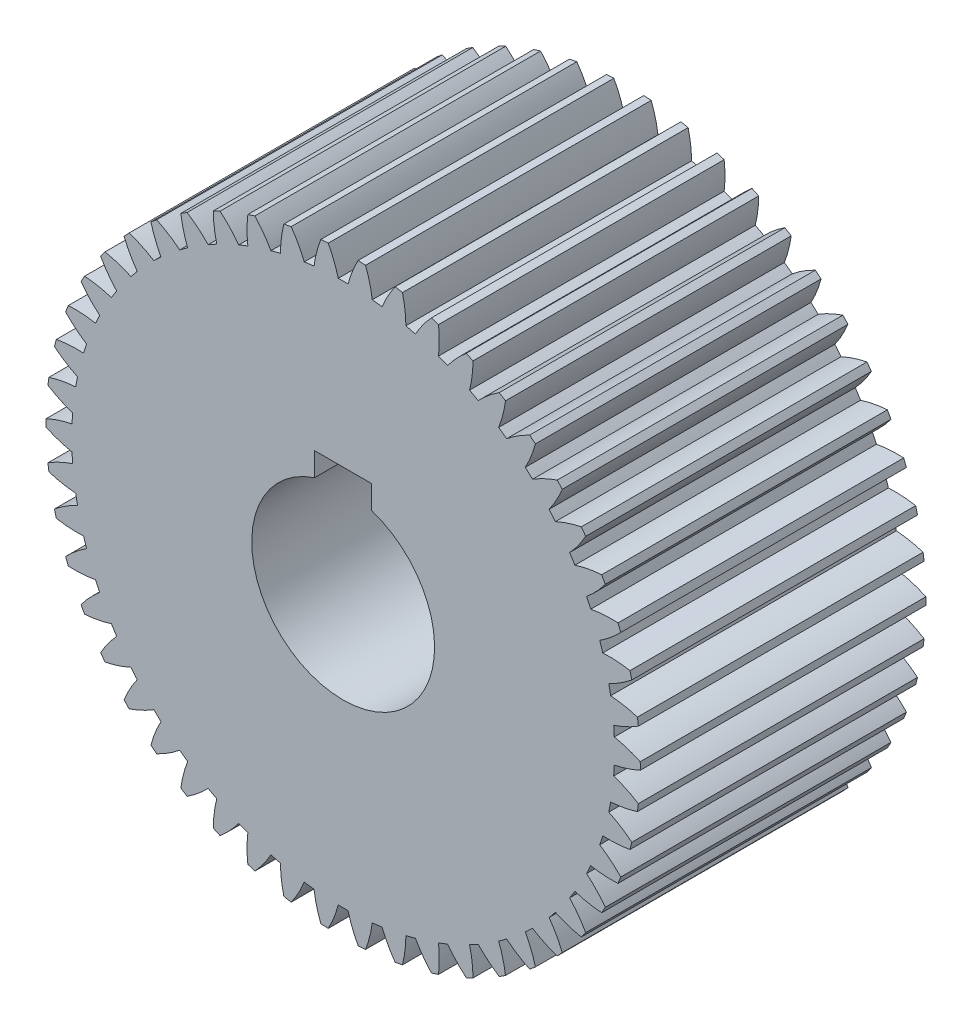
from build123d import *

# Parameters (mm, degrees)
EXTRUDE_1_DEPTH = 50


with BuildPart() as part:
    # Model → 凸台-拉伸1 (new body)
    with BuildSketch(Plane.XY):
        with BuildLine():
            ThreePointArc((-51.995930809, -0.65052232), (-49.767852675, -1.522964689), (-47.451528539, -2.12307331))
            ThreePointArc((-47.451528539, -2.12307331), (-47.405271574, -2.982486887), (-47.343450707, -3.840921267))
            ThreePointArc((-47.343450707, -3.840921267), (-49.566296381, -4.726610245), (-51.66745943, -5.871425384))
            ThreePointArc((-51.66745943, -5.871425384), (-51.589964468, -6.517328145), (-51.504395298, -7.162210897))
            ThreePointArc((-51.504395298, -7.162210897), (-49.184540203, -7.748521561), (-46.811267421, -8.053585752))
            ThreePointArc((-46.811267421, -8.053585752), (-46.657662122, -8.900425062), (-46.488738375, -9.744342221))
            ThreePointArc((-46.488738375, -9.744342221), (-48.583049984, -10.901643713), (-50.524161351, -12.300777201))
            ThreePointArc((-50.524161351, -12.300777201), (-50.366324379, -12.931874133), (-50.200604707, -13.560947131))
            ThreePointArc((-50.200604707, -13.560947131), (-47.82555815, -13.85187962), (-45.432764651, -13.857088336))
            ThreePointArc((-45.432764651, -13.857088336), (-45.174233467, -14.677998216), (-44.900870868, -15.494089076))
            ThreePointArc((-44.900870868, -15.494089076), (-46.833619866, -16.904751747), (-48.584067066, -18.536138414))
            ThreePointArc((-48.584067066, -18.536138414), (-48.348377266, -19.14247674), (-48.10512059, -19.745819127))
            ThreePointArc((-48.10512059, -19.745819127), (-45.712338476, -19.736785261), (-43.337760043, -19.442056359))
            ThreePointArc((-43.337760043, -19.442056359), (-42.978380165, -20.22409057), (-42.604889805, -20.999484892))
            ThreePointArc((-42.604889805, -20.999484892), (-44.345595586, -22.641261748), (-45.877773021, -24.479173651))
            ThreePointArc((-45.877773021, -24.479173651), (-45.567947362, -25.051191053), (-45.250989986, -25.61928776))
            ThreePointArc((-45.250989986, -25.61928776), (-42.878207916, -25.310430009), (-40.55929307, -24.720411539))
            ThreePointArc((-40.55929307, -24.720411539), (-40.104732133, -25.451236935), (-39.637004178, -26.173706286))
            ThreePointArc((-39.637004178, -26.173706286), (-41.158214772, -28.020705525), (-42.447959089, -30.036157697))
            ThreePointArc((-42.447959089, -30.036157697), (-42.068883707, -30.564833119), (-41.683224237, -31.088724921))
            ThreePointArc((-41.683224237, -31.088724921), (-39.367862404, -30.484914156), (-37.141181816, -29.608911062))
            ThreePointArc((-37.141181816, -29.608911062), (-36.598608519, -30.277002089), (-36.044019318, -30.935152697))
            ThreePointArc((-36.044019318, -30.935152697), (-37.321744325, -32.958246038), (-38.348715485, -35.119453593))
            ThreePointArc((-38.348715485, -35.119453593), (-37.906368626, -35.596449508), (-37.458089142, -36.067874318))
            ThreePointArc((-37.458089142, -36.067874318), (-35.236662184, -35.178632996), (-33.137331938, -34.03046037))
            ThreePointArc((-33.137331938, -34.03046037), (-32.515302984, -34.625280834), (-31.882598742, -35.20873327))
            ThreePointArc((-31.882598742, -35.20873327), (-32.896687675, -37.376015322), (-33.644689729, -39.648894727))
            ThreePointArc((-33.644689729, -39.648894727), (-33.146047467, -40.066688624), (-32.642217605, -40.478211791))
            ThreePointArc((-32.642217605, -40.478211791), (-30.549758752, -39.31756378), (-28.610886541, -37.915328989))
            ThreePointArc((-28.610886541, -37.915328989), (-27.919211699, -38.427498216), (-27.218370538, -38.927051086))
            ThreePointArc((-27.218370538, -38.927051086), (-27.952830609, -41.204342518), (-28.410067118, -43.553049105))
            ThreePointArc((-28.410067118, -43.553049105), (-27.862993339, -43.905052126), (-27.311558797, -44.250183684))
            ThreePointArc((-27.311558797, -44.250183684), (-25.381067375, -42.836433095), (-23.633230371, -41.202250221))
            ThreePointArc((-23.633230371, -41.202250221), (-22.882817766, -41.623690995), (-22.12489237, -42.031466054))
            ThreePointArc((-22.12489237, -42.031466054), (-22.568140706, -44.382852617), (-22.727400777, -46.770345882))
            ThreePointArc((-22.727400777, -46.770345882), (-22.140523161, -47.051006728), (-21.550180391, -47.324303747))
            ThreePointArc((-21.550180391, -47.324303747), (-19.812101404, -45.67974627), (-18.28286404, -43.839387353))
            ThreePointArc((-18.28286404, -43.839387353), (-17.485548128, -44.163453303), (-16.682491434, -44.473019692))
            ThreePointArc((-16.682491434, -44.473019692), (-16.827537742, -46.861418618), (-16.686309749, -49.250046365))
            ThreePointArc((-16.686309749, -49.250046365), (-16.068883708, -49.454938847), (-15.448942767, -49.652091269))
            ThreePointArc((-15.448942767, -49.652091269), (-13.930686758, -47.80266256), (-12.644166022, -45.785151159))
            ThreePointArc((-12.644166022, -45.785151159), (-11.81252095, -46.00673157), (-10.976997641, -46.213207244))
            ThreePointArc((-10.976997641, -46.213207244), (-10.821554456, -48.600952054), (-10.382065649, -50.953044196))
            ThreePointArc((-10.382065649, -50.953044196), (-9.743828358, -51.078937038), (-9.104066087, -51.196835651))
            ThreePointArc((-9.104066087, -51.196835651), (-7.829576861, -49.171702305), (-6.806061952, -47.00885578))
            ThreePointArc((-6.806061952, -47.00885578), (-5.953203261, -47.124456198), (-5.098390039, -47.224584911))
            ThreePointArc((-5.098390039, -47.224584911), (-4.644908792, -49.574019442), (-3.914090171, -51.852482083))
            ThreePointArc((-3.914090171, -51.852482083), (-3.265107016, -51.897389878), (-2.615612847, -51.934175352))
            ThreePointArc((-2.615612847, -51.934175352), (-1.604989859, -49.765274931), (-0.86062222, -47.491202663))
            ThreePointArc((-0.86062222, -47.491202663), (0, -47.499), (0.86062222, -47.491202663))
            ThreePointArc((0.86062222, -47.491202663), (1.604989859, -49.765274931), (2.615612847, -51.934175351))
            ThreePointArc((2.615612847, -51.934175351), (3.265107015, -51.897389878), (3.914090171, -51.852482083))
            ThreePointArc((3.914090171, -51.852482083), (4.644908792, -49.574019442), (5.098390039, -47.224584911))
            ThreePointArc((5.098390039, -47.224584911), (5.953203261, -47.124456198), (6.806061952, -47.00885578))
            ThreePointArc((6.806061952, -47.00885578), (7.829576861, -49.171702305), (9.104066087, -51.196835651))
            ThreePointArc((9.104066087, -51.196835651), (9.743828358, -51.078937038), (10.382065649, -50.953044196))
            ThreePointArc((10.382065649, -50.953044196), (10.821554456, -48.600952054), (10.976997641, -46.213207244))
            ThreePointArc((10.976997641, -46.213207244), (11.81252095, -46.00673157), (12.644166022, -45.785151159))
            ThreePointArc((12.644166022, -45.785151159), (13.930686758, -47.80266256), (15.448942767, -49.652091269))
            ThreePointArc((15.448942767, -49.652091269), (16.068883707, -49.454938847), (16.686309749, -49.250046365))
            ThreePointArc((16.686309749, -49.250046365), (16.827537742, -46.861418618), (16.682491434, -44.473019692))
            ThreePointArc((16.682491434, -44.473019692), (17.485548128, -44.163453303), (18.28286404, -43.839387353))
            ThreePointArc((18.28286404, -43.839387353), (19.812101404, -45.67974627), (21.550180391, -47.324303747))
            ThreePointArc((21.550180391, -47.324303747), (22.140523161, -47.051006728), (22.727400777, -46.770345882))
            ThreePointArc((22.727400777, -46.770345882), (22.568140706, -44.382852617), (22.12489237, -42.031466053))
            ThreePointArc((22.12489237, -42.031466053), (22.882817766, -41.623690995), (23.633230371, -41.202250221))
            ThreePointArc((23.633230371, -41.202250221), (25.381067375, -42.836433095), (27.311558797, -44.250183684))
            ThreePointArc((27.311558797, -44.250183684), (27.862993339, -43.905052126), (28.410067118, -43.553049105))
            ThreePointArc((28.410067118, -43.553049105), (27.952830609, -41.204342518), (27.218370537, -38.927051086))
            ThreePointArc((27.218370537, -38.927051086), (27.919211699, -38.427498216), (28.610886541, -37.915328989))
            ThreePointArc((28.610886541, -37.915328989), (30.549758752, -39.31756378), (32.642217605, -40.478211791))
            ThreePointArc((32.642217605, -40.478211791), (33.146047467, -40.066688624), (33.644689729, -39.648894727))
            ThreePointArc((33.644689729, -39.648894727), (32.896687675, -37.376015322), (31.882598742, -35.20873327))
            ThreePointArc((31.882598742, -35.20873327), (32.515302985, -34.625280834), (33.137331938, -34.03046037))
            ThreePointArc((33.137331938, -34.03046037), (35.236662184, -35.178632997), (37.458089142, -36.067874318))
            ThreePointArc((37.458089142, -36.067874318), (37.906368626, -35.596449508), (38.348715485, -35.119453593))
            ThreePointArc((38.348715485, -35.119453593), (37.321744325, -32.958246038), (36.044019318, -30.935152697))
            ThreePointArc((36.044019318, -30.935152697), (36.598608519, -30.277002089), (37.141181816, -29.608911062))
            ThreePointArc((37.141181816, -29.608911062), (39.367862404, -30.484914156), (41.683224237, -31.088724921))
            ThreePointArc((41.683224237, -31.088724921), (42.068883708, -30.564833119), (42.447959089, -30.036157697))
            ThreePointArc((42.447959089, -30.036157697), (41.158214772, -28.020705525), (39.637004178, -26.173706286))
            ThreePointArc((39.637004178, -26.173706286), (40.104732133, -25.451236935), (40.55929307, -24.720411539))
            ThreePointArc((40.55929307, -24.720411539), (42.878207916, -25.310430009), (45.250989986, -25.61928776))
            ThreePointArc((45.250989986, -25.61928776), (45.567947362, -25.051191053), (45.877773021, -24.479173651))
            ThreePointArc((45.877773021, -24.479173651), (44.345595586, -22.641261748), (42.604889805, -20.999484892))
            ThreePointArc((42.604889805, -20.999484892), (42.978380165, -20.22409057), (43.337760043, -19.442056359))
            ThreePointArc((43.337760043, -19.442056359), (45.712338476, -19.736785261), (48.10512059, -19.745819127))
            ThreePointArc((48.10512059, -19.745819127), (48.348377266, -19.14247674), (48.584067066, -18.536138414))
            ThreePointArc((48.584067066, -18.536138414), (46.833619866, -16.904751747), (44.900870868, -15.494089076))
            ThreePointArc((44.900870868, -15.494089076), (45.174233468, -14.677998216), (45.432764651, -13.857088336))
            ThreePointArc((45.432764651, -13.857088336), (47.82555815, -13.85187962), (50.200604707, -13.560947131))
            ThreePointArc((50.200604707, -13.560947131), (50.366324379, -12.931874133), (50.524161351, -12.300777201))
            ThreePointArc((50.524161351, -12.300777201), (48.583049984, -10.901643713), (46.488738375, -9.744342221))
            ThreePointArc((46.488738375, -9.744342221), (46.657662122, -8.900425061), (46.811267421, -8.053585752))
            ThreePointArc((46.811267421, -8.053585752), (49.184540203, -7.748521561), (51.504395298, -7.162210897))
            ThreePointArc((51.504395298, -7.162210897), (51.589964468, -6.517328145), (51.66745943, -5.871425384))
            ThreePointArc((51.66745943, -5.871425384), (49.566296381, -4.726610245), (47.343450707, -3.840921267))
            ThreePointArc((47.343450707, -3.840921267), (47.405271574, -2.982486887), (47.451528539, -2.12307331))
            ThreePointArc((47.451528539, -2.12307331), (49.767852675, -1.522964689), (51.995930809, -0.65052232))
            ThreePointArc((51.995930809, -0.65052232), (52, 0), (51.995930809, 0.65052232))
            ThreePointArc((51.995930809, 0.65052232), (49.767852675, 1.522964689), (47.451528539, 2.12307331))
            ThreePointArc((47.451528539, 2.12307331), (47.405271574, 2.982486887), (47.343450707, 3.840921267))
            ThreePointArc((47.343450707, 3.840921267), (49.566296381, 4.726610245), (51.66745943, 5.871425384))
            ThreePointArc((51.66745943, 5.871425384), (51.589964468, 6.517328145), (51.504395298, 7.162210897))
            ThreePointArc((51.504395298, 7.162210897), (49.184540203, 7.748521561), (46.811267421, 8.053585752))
            ThreePointArc((46.811267421, 8.053585752), (46.657662122, 8.900425062), (46.488738375, 9.744342221))
            ThreePointArc((46.488738375, 9.744342221), (48.583049984, 10.901643713), (50.524161351, 12.300777201))
            ThreePointArc((50.524161351, 12.300777201), (50.366324379, 12.931874133), (50.200604707, 13.560947131))
            ThreePointArc((50.200604707, 13.560947131), (47.82555815, 13.85187962), (45.432764651, 13.857088336))
            ThreePointArc((45.432764651, 13.857088336), (45.174233468, 14.677998216), (44.900870868, 15.494089076))
            ThreePointArc((44.900870868, 15.494089076), (46.833619866, 16.904751747), (48.584067066, 18.536138414))
            ThreePointArc((48.584067066, 18.536138414), (48.348377266, 19.14247674), (48.10512059, 19.745819127))
            ThreePointArc((48.10512059, 19.745819127), (45.712338476, 19.736785261), (43.337760043, 19.442056359))
            ThreePointArc((43.337760043, 19.442056359), (42.978380165, 20.22409057), (42.604889805, 20.999484892))
            ThreePointArc((42.604889805, 20.999484892), (44.345595586, 22.641261748), (45.877773021, 24.479173651))
            ThreePointArc((45.877773021, 24.479173651), (45.567947362, 25.051191053), (45.250989986, 25.61928776))
            ThreePointArc((45.250989986, 25.61928776), (42.878207916, 25.310430009), (40.55929307, 24.720411539))
            ThreePointArc((40.55929307, 24.720411539), (40.104732133, 25.451236935), (39.637004178, 26.173706286))
            ThreePointArc((39.637004178, 26.173706286), (41.158214772, 28.020705525), (42.447959089, 30.036157697))
            ThreePointArc((42.447959089, 30.036157697), (42.068883708, 30.564833119), (41.683224237, 31.088724921))
            ThreePointArc((41.683224237, 31.088724921), (39.367862404, 30.484914156), (37.141181816, 29.608911062))
            ThreePointArc((37.141181816, 29.608911062), (36.598608519, 30.277002089), (36.044019318, 30.935152697))
            ThreePointArc((36.044019318, 30.935152697), (37.321744325, 32.958246038), (38.348715485, 35.119453593))
            ThreePointArc((38.348715485, 35.119453593), (37.906368626, 35.596449508), (37.458089142, 36.067874318))
            ThreePointArc((37.458089142, 36.067874318), (35.236662184, 35.178632996), (33.137331938, 34.03046037))
            ThreePointArc((33.137331938, 34.03046037), (32.515302985, 34.625280834), (31.882598742, 35.20873327))
            ThreePointArc((31.882598742, 35.20873327), (32.896687675, 37.376015322), (33.644689729, 39.648894727))
            ThreePointArc((33.644689729, 39.648894727), (33.146047467, 40.066688624), (32.642217605, 40.478211791))
            ThreePointArc((32.642217605, 40.478211791), (30.549758752, 39.31756378), (28.610886541, 37.915328989))
            ThreePointArc((28.610886541, 37.915328989), (27.919211699, 38.427498216), (27.218370538, 38.927051086))
            ThreePointArc((27.218370538, 38.927051086), (27.952830609, 41.204342518), (28.410067118, 43.553049105))
            ThreePointArc((28.410067118, 43.553049105), (27.862993339, 43.905052126), (27.311558797, 44.250183684))
            ThreePointArc((27.311558797, 44.250183684), (25.381067375, 42.836433095), (23.633230371, 41.202250221))
            ThreePointArc((23.633230371, 41.202250221), (22.882817766, 41.623690995), (22.12489237, 42.031466054))
            ThreePointArc((22.12489237, 42.031466054), (22.568140706, 44.382852617), (22.727400777, 46.770345882))
            ThreePointArc((22.727400777, 46.770345882), (22.140523161, 47.051006728), (21.550180391, 47.324303747))
            ThreePointArc((21.550180391, 47.324303747), (19.812101404, 45.67974627), (18.28286404, 43.839387353))
            ThreePointArc((18.28286404, 43.839387353), (17.485548128, 44.163453303), (16.682491434, 44.473019692))
            ThreePointArc((16.682491434, 44.473019692), (16.827537742, 46.861418618), (16.686309749, 49.250046365))
            ThreePointArc((16.686309749, 49.250046365), (16.068883708, 49.454938847), (15.448942767, 49.652091269))
            ThreePointArc((15.448942767, 49.652091269), (13.930686758, 47.80266256), (12.644166022, 45.785151159))
            ThreePointArc((12.644166022, 45.785151159), (11.81252095, 46.00673157), (10.976997641, 46.213207244))
            ThreePointArc((10.976997641, 46.213207244), (10.821554456, 48.600952054), (10.382065649, 50.953044196))
            ThreePointArc((10.382065649, 50.953044196), (9.743828358, 51.078937038), (9.104066087, 51.196835651))
            ThreePointArc((9.104066087, 51.196835651), (7.829576861, 49.171702305), (6.806061952, 47.00885578))
            ThreePointArc((6.806061952, 47.00885578), (5.953203261, 47.124456198), (5.098390039, 47.224584911))
            ThreePointArc((5.098390039, 47.224584911), (4.644908792, 49.574019442), (3.914090171, 51.852482083))
            ThreePointArc((3.914090171, 51.852482083), (3.265107016, 51.897389878), (2.615612847, 51.934175352))
            ThreePointArc((2.615612847, 51.934175352), (1.604989859, 49.765274931), (0.86062222, 47.491202663))
            ThreePointArc((0.86062222, 47.491202663), (0, 47.499), (-0.86062222, 47.491202663))
            ThreePointArc((-0.86062222, 47.491202663), (-1.604989859, 49.765274931), (-2.615612847, 51.934175351))
            ThreePointArc((-2.615612847, 51.934175351), (-3.265107015, 51.897389878), (-3.914090171, 51.852482083))
            ThreePointArc((-3.914090171, 51.852482083), (-4.644908792, 49.574019442), (-5.098390039, 47.224584911))
            ThreePointArc((-5.098390039, 47.224584911), (-5.953203261, 47.124456198), (-6.806061952, 47.00885578))
            ThreePointArc((-6.806061952, 47.00885578), (-7.829576861, 49.171702305), (-9.104066087, 51.196835651))
            ThreePointArc((-9.104066087, 51.196835651), (-9.743828358, 51.078937038), (-10.382065649, 50.953044196))
            ThreePointArc((-10.382065649, 50.953044196), (-10.821554456, 48.600952054), (-10.976997641, 46.213207244))
            ThreePointArc((-10.976997641, 46.213207244), (-11.81252095, 46.00673157), (-12.644166022, 45.785151159))
            ThreePointArc((-12.644166022, 45.785151159), (-13.930686758, 47.80266256), (-15.448942767, 49.652091269))
            ThreePointArc((-15.448942767, 49.652091269), (-16.068883707, 49.454938847), (-16.686309749, 49.250046365))
            ThreePointArc((-16.686309749, 49.250046365), (-16.827537742, 46.861418618), (-16.682491434, 44.473019692))
            ThreePointArc((-16.682491434, 44.473019692), (-17.485548128, 44.163453303), (-18.28286404, 43.839387353))
            ThreePointArc((-18.28286404, 43.839387353), (-19.812101404, 45.67974627), (-21.550180391, 47.324303747))
            ThreePointArc((-21.550180391, 47.324303747), (-22.140523161, 47.051006728), (-22.727400777, 46.770345882))
            ThreePointArc((-22.727400777, 46.770345882), (-22.568140706, 44.382852617), (-22.12489237, 42.031466053))
            ThreePointArc((-22.12489237, 42.031466053), (-22.882817766, 41.623690995), (-23.633230371, 41.202250221))
            ThreePointArc((-23.633230371, 41.202250221), (-25.381067375, 42.836433095), (-27.311558797, 44.250183684))
            ThreePointArc((-27.311558797, 44.250183684), (-27.862993339, 43.905052126), (-28.410067118, 43.553049105))
            ThreePointArc((-28.410067118, 43.553049105), (-27.952830609, 41.204342518), (-27.218370537, 38.927051086))
            ThreePointArc((-27.218370537, 38.927051086), (-27.919211699, 38.427498216), (-28.610886541, 37.915328989))
            ThreePointArc((-28.610886541, 37.915328989), (-30.549758752, 39.31756378), (-32.642217605, 40.478211791))
            ThreePointArc((-32.642217605, 40.478211791), (-33.146047467, 40.066688624), (-33.644689729, 39.648894727))
            ThreePointArc((-33.644689729, 39.648894727), (-32.896687675, 37.376015322), (-31.882598742, 35.20873327))
            ThreePointArc((-31.882598742, 35.20873327), (-32.515302984, 34.625280834), (-33.137331938, 34.03046037))
            ThreePointArc((-33.137331938, 34.03046037), (-35.236662184, 35.178632997), (-37.458089142, 36.067874318))
            ThreePointArc((-37.458089142, 36.067874318), (-37.906368626, 35.596449508), (-38.348715485, 35.119453593))
            ThreePointArc((-38.348715485, 35.119453593), (-37.321744325, 32.958246038), (-36.044019318, 30.935152697))
            ThreePointArc((-36.044019318, 30.935152697), (-36.598608519, 30.277002089), (-37.141181816, 29.608911062))
            ThreePointArc((-37.141181816, 29.608911062), (-39.367862404, 30.484914156), (-41.683224237, 31.088724921))
            ThreePointArc((-41.683224237, 31.088724921), (-42.068883707, 30.564833119), (-42.447959089, 30.036157697))
            ThreePointArc((-42.447959089, 30.036157697), (-41.158214772, 28.020705525), (-39.637004178, 26.173706286))
            ThreePointArc((-39.637004178, 26.173706286), (-40.104732133, 25.451236935), (-40.55929307, 24.720411539))
            ThreePointArc((-40.55929307, 24.720411539), (-42.878207916, 25.310430009), (-45.250989986, 25.61928776))
            ThreePointArc((-45.250989986, 25.61928776), (-45.567947362, 25.051191053), (-45.877773021, 24.479173651))
            ThreePointArc((-45.877773021, 24.479173651), (-44.345595586, 22.641261748), (-42.604889805, 20.999484892))
            ThreePointArc((-42.604889805, 20.999484892), (-42.978380165, 20.22409057), (-43.337760043, 19.442056359))
            ThreePointArc((-43.337760043, 19.442056359), (-45.712338476, 19.736785261), (-48.10512059, 19.745819127))
            ThreePointArc((-48.10512059, 19.745819127), (-48.348377266, 19.14247674), (-48.584067066, 18.536138414))
            ThreePointArc((-48.584067066, 18.536138414), (-46.833619866, 16.904751747), (-44.900870868, 15.494089076))
            ThreePointArc((-44.900870868, 15.494089076), (-45.174233467, 14.677998216), (-45.432764651, 13.857088336))
            ThreePointArc((-45.432764651, 13.857088336), (-47.82555815, 13.85187962), (-50.200604707, 13.560947131))
            ThreePointArc((-50.200604707, 13.560947131), (-50.366324379, 12.931874133), (-50.524161351, 12.300777201))
            ThreePointArc((-50.524161351, 12.300777201), (-48.583049984, 10.901643713), (-46.488738375, 9.744342221))
            ThreePointArc((-46.488738375, 9.744342221), (-46.657662122, 8.900425061), (-46.811267421, 8.053585752))
            ThreePointArc((-46.811267421, 8.053585752), (-49.184540203, 7.748521561), (-51.504395298, 7.162210897))
            ThreePointArc((-51.504395298, 7.162210897), (-51.589964468, 6.517328145), (-51.66745943, 5.871425384))
            ThreePointArc((-51.66745943, 5.871425384), (-49.566296381, 4.726610245), (-47.343450707, 3.840921267))
            ThreePointArc((-47.343450707, 3.840921267), (-47.405271574, 2.982486887), (-47.451528539, 2.12307331))
            ThreePointArc((-47.451528539, 2.12307331), (-49.767852675, 1.522964689), (-51.995930809, 0.65052232))
            ThreePointArc((-51.995930809, 0.65052232), (-52, 0), (-51.995930809, -0.65052232))
        make_face()
        with BuildLine():
            Line((5, 15.198684154), (5, 19.3))
            Line((5, 19.3), (-5, 19.3))
            Line((-5, 19.3), (-5, 15.198684154))
            ThreePointArc((-5, 15.198684154), (0, -15.999999998), (5, 15.198684154))
        make_face(mode=Mode.SUBTRACT)
    extrude(amount=EXTRUDE_1_DEPTH)


solid = part.part
